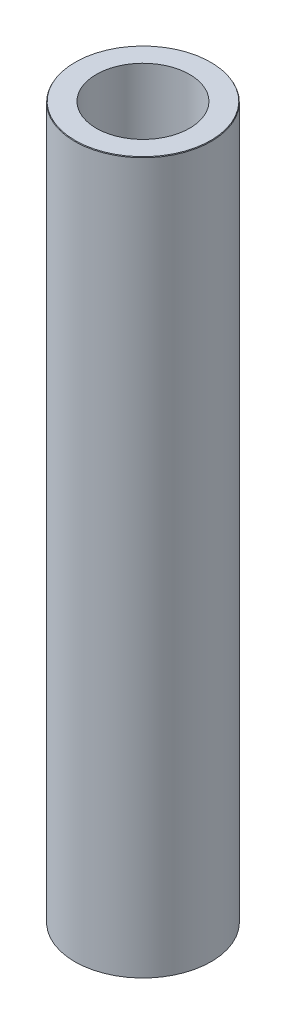
from build123d import *
from OCP.BRepFilletAPI import BRepFilletAPI_MakeChamfer

# Parameters (mm, degrees)
SKETCH1_R           = 57.5
BOSS_EXTRUDE1_DEPTH = 600
SKETCH2_R           = 39.373373926
CUT_EXTRUDE1_DEPTH  = 606.485342515
CHAMFER1_SIZE       = 0.579091625
CHAMFER1_SIZE2      = 0.334338706


with BuildPart() as part:
    # Sketch1 → Boss-Extrude1 (new body)
    with BuildSketch(Plane(origin=(0, 0, 0), x_dir=(1, 0, 0), z_dir=(0, 1, 0))):
        Circle(SKETCH1_R)
    extrude(amount=BOSS_EXTRUDE1_DEPTH)

    # Sketch2 → Cut-Extrude1 (cut, through all)
    with BuildSketch(Plane(origin=(0, 0, 0), x_dir=(1, 0, 0), z_dir=(0, 1, 0))):
        Circle(SKETCH2_R)
    extrude(amount=CUT_EXTRUDE1_DEPTH, mode=Mode.SUBTRACT)

    # Chamfer1: one chamfer whose edges measure the first distance from different faces: ONE call of the kernel's chamfer builder (chamfer() names one face for all edges)
    chamfer1_edges_1 = [part.edges().sort_by_distance(p)[0] for p in [
        (-57.5, 600, 0),
    ]]
    chamfer1_side_1 = [part.faces().sort_by_distance(p)[0] for p in [
        (-57.5, 300, 0),
    ]]
    chamfer1_edges_2 = [part.edges().sort_by_distance(p)[0] for p in [
        (-57.5, 0, 0),
    ]]
    chamfer1_side_2 = [part.faces().sort_by_distance(p)[0] for p in [
        (-55.873654403, 0, 0),
    ]]
    chamfer1 = BRepFilletAPI_MakeChamfer(part.part.solid().wrapped)
    for e in chamfer1_edges_1:
        chamfer1.Add(CHAMFER1_SIZE, CHAMFER1_SIZE2, e.wrapped, chamfer1_side_1[0].wrapped)  # the first distance lies on this face
    for e in chamfer1_edges_2:
        chamfer1.Add(CHAMFER1_SIZE, CHAMFER1_SIZE2, e.wrapped, chamfer1_side_2[0].wrapped)  # the first distance lies on this face
    add(Compound.cast(chamfer1.Shape()), mode=Mode.REPLACE)


solid = part.part
